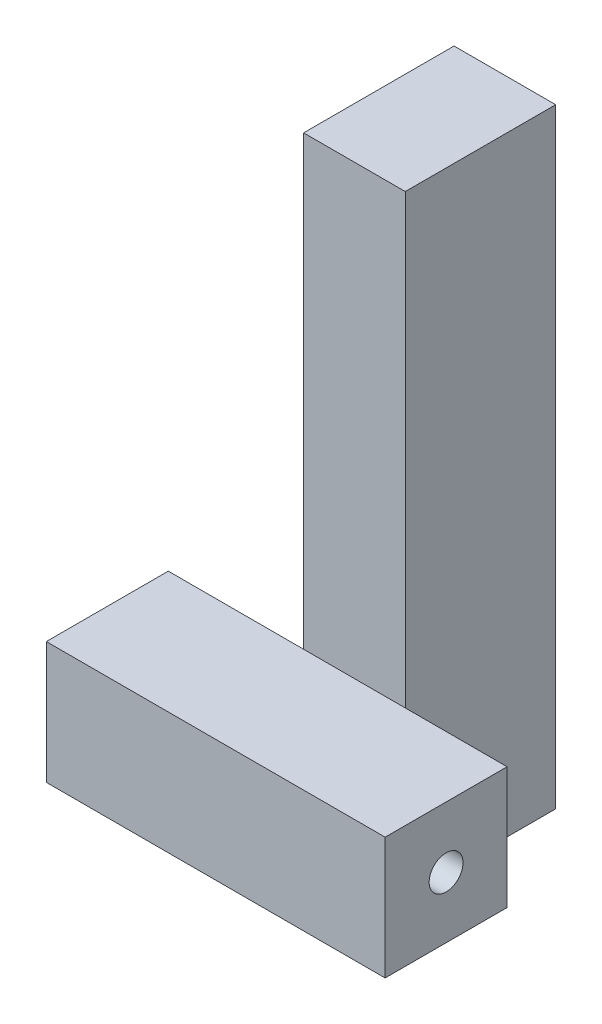
from build123d import *

# Parameters (mm, degrees)
SKETCH1_W           = 127
SKETCH1_H           = 45.72
BOSS_EXTRUDE1_DEPTH = 45.72
SKETCH2_W           = 38.1
SKETCH2_H           = 228.6
BOSS_EXTRUDE2_DEPTH = 56.388
SKETCH3_R           = 6.35
CUT_EXTRUDE1_DEPTH  = 12.7
CUT_EXTRUDE2_START  = -12.7
SKETCH4_R           = 6.35
CUT_EXTRUDE2_DEPTH  = 12.7


with BuildPart() as part:
    # Sketch1 → Boss-Extrude1 (new body)
    with BuildSketch(Plane.XY):
        Rectangle(SKETCH1_W, SKETCH1_H)
    extrude(amount=BOSS_EXTRUDE1_DEPTH)

    # Sketch2 → Boss-Extrude2 (add)
    with BuildSketch(Plane(origin=(0, 0, 0), x_dir=(-1, 0, 0), z_dir=(0, 0, -1))):
        with Locations((-6.276150489, 76.2)):
            Rectangle(SKETCH2_W, SKETCH2_H)
    extrude(amount=BOSS_EXTRUDE2_DEPTH)

    # Sketch3 → Cut-Extrude1 (cut)
    with BuildSketch(Plane(origin=(63.5, 0, 0), x_dir=(0, 0, -1), z_dir=(1, 0, 0))):
        with Locations((-22.86, 0)):
            Circle(SKETCH3_R)
    extrude(amount=-CUT_EXTRUDE1_DEPTH, mode=Mode.SUBTRACT)

    # Sketch4 → Cut-Extrude2 (cut)
    with BuildSketch(Plane.ZY.offset(63.5).offset(CUT_EXTRUDE2_START)):
        with Locations((22.86, 0)):
            Circle(SKETCH4_R)
    extrude(amount=CUT_EXTRUDE2_DEPTH, mode=Mode.SUBTRACT)


solid = part.part
